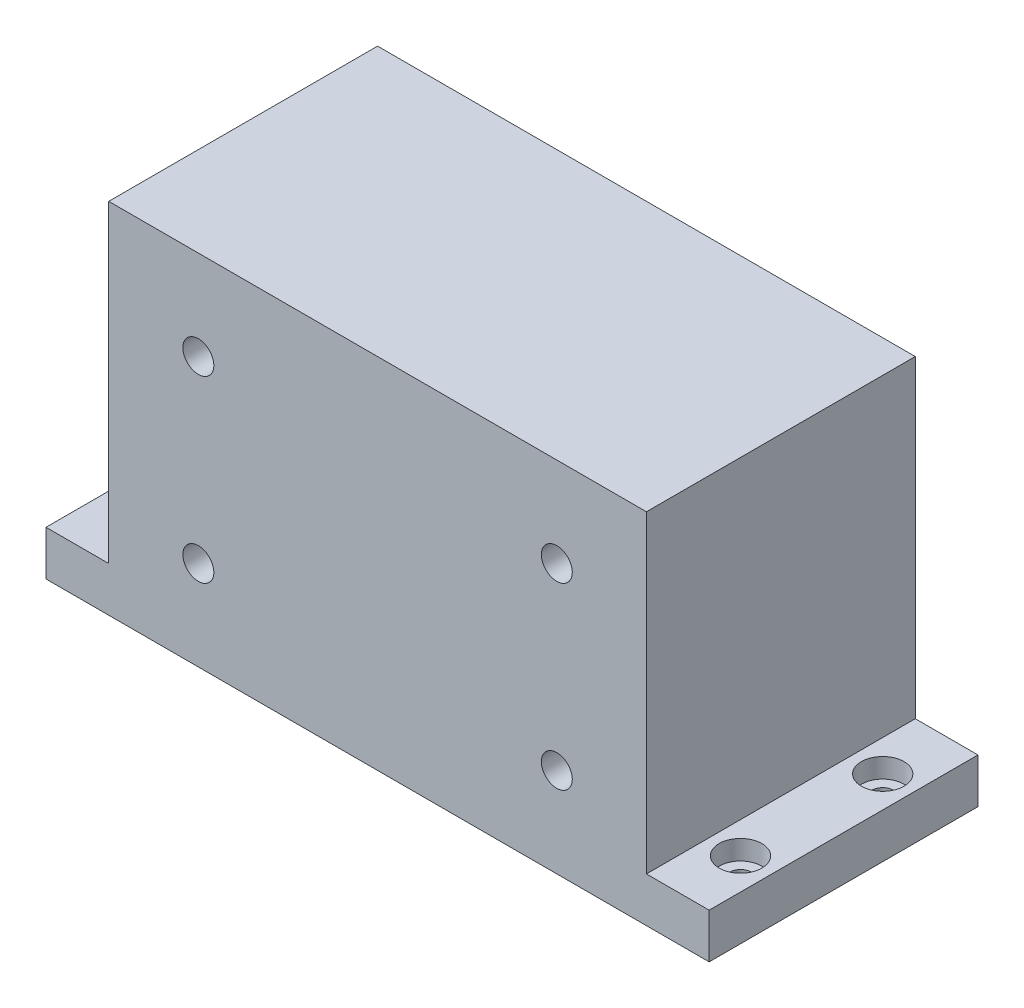
from build123d import *

# Parameters (mm, degrees)
SKETCH5_W                                      = 60
SKETCH5_H                                      = 30
BOSS_EXTRUDE3_DEPTH                            = 40
SKETCH7_W                                      = 40
SKETCH7_H                                      = 20
CUT_EXTRUDE1_DEPTH                             = 15
FILLET1_R                                      = 3
FILLET2_R                                      = 3
FILLET3_R                                      = 3
FILLET4_R                                      = 3
SKETCH9_W                                      = 30
SKETCH9_H                                      = 5
BOSS_EXTRUDE4_DEPTH                            = 7
SKETCH10_W                                     = 30
SKETCH10_H                                     = 5
BOSS_EXTRUDE5_DEPTH                            = 7
SKETCH12_R                                     = 2
CUT_EXTRUDE2_DEPTH                             = 10
SKETCH13_W                                     = 64
SKETCH13_H                                     = 20
CUT_EXTRUDE3_DEPTH                             = 1.5
CBORE_FOR_2_SOCKET_HEAD_CAP_SCREW1_D           = 2.4384
CBORE_FOR_2_SOCKET_HEAD_CAP_SCREW1_DEPTH       = 15
CBORE_FOR_2_SOCKET_HEAD_CAP_SCREW1_CBORE_D     = 4.7625
CBORE_FOR_2_SOCKET_HEAD_CAP_SCREW1_CBORE_DEPTH = 2.1844
CBORE_FOR_2_SOCKET_HEAD_CAP_SCREW1_TIP         = 0.732569267
F_2_56_TAPPED_HOLE2_D                          = 1.778
F_2_56_TAPPED_HOLE2_DEPTH                      = 15
F_2_56_TAPPED_HOLE2_TIP                        = 0.53416509
F_2_56_TAPPED_HOLE3_D                          = 1.778
F_2_56_TAPPED_HOLE3_DEPTH                      = 15
F_2_56_TAPPED_HOLE3_TIP                        = 0.53416509
CBORE_FOR_2_SOCKET_HEAD_CAP_SCREW3_D           = 2.4384
CBORE_FOR_2_SOCKET_HEAD_CAP_SCREW3_DEPTH       = 15
CBORE_FOR_2_SOCKET_HEAD_CAP_SCREW3_CBORE_D     = 4.7625
CBORE_FOR_2_SOCKET_HEAD_CAP_SCREW3_CBORE_DEPTH = 2.1844
CBORE_FOR_2_SOCKET_HEAD_CAP_SCREW3_TIP         = 0.732569267
F_8_32_TAPPED_HOLE1_D                          = 3.4544
F_8_32_TAPPED_HOLE1_DEPTH                      = 11
F_8_32_TAPPED_HOLE1_TIP                        = 1.037806461
SKETCH30_R                                     = 1.5
SKETCH30_R_2                                   = 3
CUT_EXTRUDE5_DEPTH                             = 12


with BuildPart() as part:
    # Sketch5 → Boss-Extrude3 (new body)
    with BuildSketch(Plane(origin=(0, 0, 0), x_dir=(1, 0, 0), z_dir=(0, 1, 0))):
        Rectangle(SKETCH5_W, SKETCH5_H)
    extrude(amount=BOSS_EXTRUDE3_DEPTH)

    # Sketch7 → Cut-Extrude1 (cut)
    with BuildSketch(Plane(origin=(0, 0, -15), x_dir=(-1, 0, 0), z_dir=(0, 0, -1))):
        with Locations((0, 20)):
            Rectangle(SKETCH7_W, SKETCH7_H)
    extrude(amount=-CUT_EXTRUDE1_DEPTH, mode=Mode.SUBTRACT)

    # Fillet1
    fillet1_edges = [part.edges().sort_by_distance(p)[0] for p in [
        (20, 10, -7.5),
    ]]
    fillet(fillet1_edges, radius=FILLET1_R)

    # Fillet2
    fillet2_edges = [part.edges().sort_by_distance(p)[0] for p in [
        (-20, 10, -7.5),
    ]]
    fillet(fillet2_edges, radius=FILLET2_R)

    # Fillet3
    fillet3_edges = [part.edges().sort_by_distance(p)[0] for p in [
        (-20, 30, -7.5),
    ]]
    fillet(fillet3_edges, radius=FILLET3_R)

    # Fillet4
    fillet4_edges = [part.edges().sort_by_distance(p)[0] for p in [
        (20, 30, -7.5),
    ]]
    fillet(fillet4_edges, radius=FILLET4_R)

    # Sketch9 → Boss-Extrude4 (add)
    with BuildSketch(Plane.ZY.offset(30)):
        with Locations((0, 2.5)):
            Rectangle(SKETCH9_W, SKETCH9_H)
    extrude(amount=BOSS_EXTRUDE4_DEPTH)

    # Sketch10 → Boss-Extrude5 (add)
    with BuildSketch(Plane(origin=(30, 0, 0), x_dir=(0, 0, -1), z_dir=(1, 0, 0))):
        with Locations((0, 2.5)):
            Rectangle(SKETCH10_W, SKETCH10_H)
    extrude(amount=BOSS_EXTRUDE5_DEPTH)

    # Sketch12 → Cut-Extrude2 (cut)
    with BuildSketch(Plane.ZY.offset(30)):
        with Locations((-7.531524718, 22.710545663)):
            Circle(SKETCH12_R)
    extrude(amount=-CUT_EXTRUDE2_DEPTH, mode=Mode.SUBTRACT)

    # Sketch13 → Cut-Extrude3 (cut)
    with BuildSketch(Plane(origin=(0, 0, 0), x_dir=(-1, 0, 0), z_dir=(0, -1, 0))):
        Rectangle(SKETCH13_W, SKETCH13_H)
    extrude(amount=-CUT_EXTRUDE3_DEPTH, mode=Mode.SUBTRACT)

    # CBORE for #2 Socket Head Cap Screw1
    with Locations(Plane(origin=(33.5, 5, 8), x_dir=(0, 0, 1), z_dir=(0, 1, 0))):
        with Locations((0, 0), (-15.84853595, 0.01844385)):
            CounterBoreHole(CBORE_FOR_2_SOCKET_HEAD_CAP_SCREW1_D / 2, CBORE_FOR_2_SOCKET_HEAD_CAP_SCREW1_CBORE_D / 2, CBORE_FOR_2_SOCKET_HEAD_CAP_SCREW1_CBORE_DEPTH, depth=CBORE_FOR_2_SOCKET_HEAD_CAP_SCREW1_DEPTH)
            with Locations((0, 0, -(CBORE_FOR_2_SOCKET_HEAD_CAP_SCREW1_DEPTH + CBORE_FOR_2_SOCKET_HEAD_CAP_SCREW1_TIP / 2))):  # 118° drill point
                Cone(0, CBORE_FOR_2_SOCKET_HEAD_CAP_SCREW1_D / 2, CBORE_FOR_2_SOCKET_HEAD_CAP_SCREW1_TIP, mode=Mode.SUBTRACT)

    # #2-56 Tapped Hole2
    with Locations(Plane(origin=(25, 36, -15), x_dir=(-1, 0, 0), z_dir=(0, 0, -1))):
        with Locations((0, 0), (0, -32), (50, -32)):
            Hole(F_2_56_TAPPED_HOLE2_D / 2, depth=F_2_56_TAPPED_HOLE2_DEPTH)
            with Locations((0, 0, -(F_2_56_TAPPED_HOLE2_DEPTH + F_2_56_TAPPED_HOLE2_TIP / 2))):  # 118° drill point
                Cone(0, F_2_56_TAPPED_HOLE2_D / 2, F_2_56_TAPPED_HOLE2_TIP, mode=Mode.SUBTRACT)

    # #2-56 Tapped Hole3
    with Locations(Plane(origin=(-25, 36, -15), x_dir=(-1, 0, 0), z_dir=(0, 0, -1))):
        with Locations((0, 0)):
            Hole(F_2_56_TAPPED_HOLE3_D / 2, depth=F_2_56_TAPPED_HOLE3_DEPTH)
            with Locations((0, 0, -(F_2_56_TAPPED_HOLE3_DEPTH + F_2_56_TAPPED_HOLE3_TIP / 2))):  # 118° drill point
                Cone(0, F_2_56_TAPPED_HOLE3_D / 2, F_2_56_TAPPED_HOLE3_TIP, mode=Mode.SUBTRACT)

    # CBORE for #2 Socket Head Cap Screw3
    with Locations(Plane(origin=(0, 5, 0), x_dir=(1, 0, 0), z_dir=(0, 1, 0))):
        with Locations((-33.5, 8), (-33.5, -8)):
            CounterBoreHole(CBORE_FOR_2_SOCKET_HEAD_CAP_SCREW3_D / 2, CBORE_FOR_2_SOCKET_HEAD_CAP_SCREW3_CBORE_D / 2, CBORE_FOR_2_SOCKET_HEAD_CAP_SCREW3_CBORE_DEPTH, depth=CBORE_FOR_2_SOCKET_HEAD_CAP_SCREW3_DEPTH)
            with Locations((0, 0, -(CBORE_FOR_2_SOCKET_HEAD_CAP_SCREW3_DEPTH + CBORE_FOR_2_SOCKET_HEAD_CAP_SCREW3_TIP / 2))):  # 118° drill point
                Cone(0, CBORE_FOR_2_SOCKET_HEAD_CAP_SCREW3_D / 2, CBORE_FOR_2_SOCKET_HEAD_CAP_SCREW3_TIP, mode=Mode.SUBTRACT)

    # #8-32 Tapped Hole1
    with Locations(Plane.XY.offset(15)):
        with Locations((-20, 30), (-20, 10), (20, 10), (20, 30)):
            Hole(F_8_32_TAPPED_HOLE1_D / 2, depth=F_8_32_TAPPED_HOLE1_DEPTH)
            with Locations((0, 0, -(F_8_32_TAPPED_HOLE1_DEPTH + F_8_32_TAPPED_HOLE1_TIP / 2))):  # 118° drill point
                Cone(0, F_8_32_TAPPED_HOLE1_D / 2, F_8_32_TAPPED_HOLE1_TIP, mode=Mode.SUBTRACT)

    # Sketch30 → Cut-Extrude5 (cut)
    with BuildSketch(Plane(origin=(0, 0, 0), x_dir=(-1, 0, 0), z_dir=(0, 0, -1))):
        with Locations((-10, 20)):
            Circle(SKETCH30_R)
        with Locations((10, 20)):
            Circle(SKETCH30_R_2)
    extrude(amount=-CUT_EXTRUDE5_DEPTH, mode=Mode.SUBTRACT)


solid = part.part
